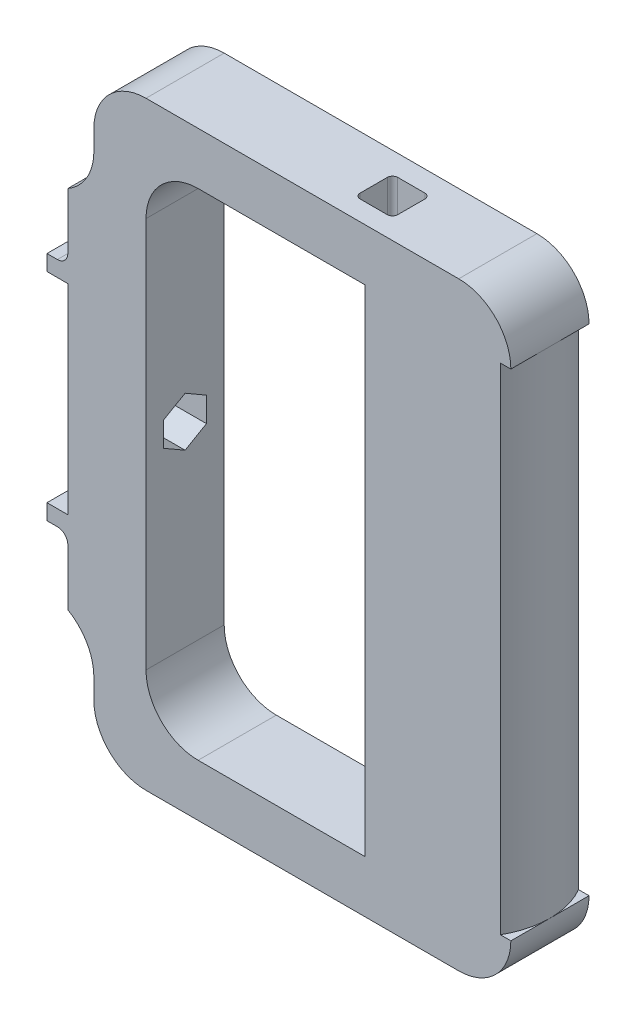
from build123d import *

# Parameters (mm, degrees)
MAIN_BODY_DEPTH             = 15
M5_HOLE_REACH               = 145.788
SKETCH2_R                   = 2.725
GRIP_REACH                  = 134.853
SKETCH8_W                   = 7.2
SKETCH8_H                   = 7.2
BUTTON_1_DEPTH              = 7
SKETCH9_R                   = 2
HOLE_WIRES_BUTTON_1_DEPTH   = 3
OUTER_FILLET_R              = 10
SKETCH13_W                  = 7.2
SKETCH13_H                  = 7.2
BUTTON_2_DEPTH              = 10
BUTTONS_FILLET_R            = 1
SKETCH16_R                  = 2
WIRE_ROUTING_DEPTH          = 40
M5_NUT_DEPTH                = 6
SKETCH18_W                  = 15
SKETCH18_H                  = 3
DOVETAIL_MALE_SLOT_DEPTH    = 4
DOVETAIL_MALE_SLOT_FILLET_R = 2


with BuildPart() as part:
    # Model → Main Body (new body)
    with BuildSketch(Plane.XY):
        Polygon((80, 115), (80, 105), (10, 105), (10, 10), (80, 10), (80, 0), (0, 0), (0, 22.5), (-5, 22.5), (-5, 92.5), (0, 92.5), (0, 115), align=None)
    extrude(amount=MAIN_BODY_DEPTH)

    # Sketch2 → M5 Hole (cut, up to next)
    with BuildSketch(Plane.ZY.offset(5), mode=Mode.PRIVATE) as m5_hole_sk1:
        with Locations((7.5, 57.5)):
            Circle(SKETCH2_R)
    m5_hole_tool1 = extrude(m5_hole_sk1.sketch, amount=-M5_HOLE_REACH, mode=Mode.PRIVATE) & part.part
    add(m5_hole_tool1.solids().sort_by_distance((-5, 57.5, 7.5))[0], mode=Mode.SUBTRACT)

    # Sketch6 → Grip (add, up to next)
    with BuildSketch(Plane.XZ.offset(-105), mode=Mode.PRIVATE) as grip_sk1:
        with BuildLine():
            Line((52.009621164, 15), (77.990380713, 15))
            ThreePointArc((77.990380713, 15), (80, 7.5), (77.990380713, 0))
            Line((77.990380713, 0), (52.009621164, 0))
            ThreePointArc((52.009621164, 0), (50.000002221, 7.5), (52.009621164, 15))
        make_face()
    grip_tool1 = extrude(grip_sk1.sketch, amount=GRIP_REACH, mode=Mode.PRIVATE) - part.part
    add(grip_tool1.solids().sort_by_distance((65.000001, 105, 7.5))[0])

    # Sketch8 → Button 1 (cut)
    with BuildSketch(Plane(origin=(0, 115, 0), x_dir=(1, 0, 0), z_dir=(0, 1, 0))):
        with Locations((49.9, -7.6)):
            Rectangle(SKETCH8_W, SKETCH8_H)
    extrude(amount=-BUTTON_1_DEPTH, mode=Mode.SUBTRACT)

    # Sketch9 → Hole Wires Button 1 (cut)
    with BuildSketch(Plane(origin=(0, 108, 0), x_dir=(1, 0, 0), z_dir=(0, 1, 0))):
        with Locations(Location((49.798571137, -7.7, 0), (0, 0, 270))):
            Circle(SKETCH9_R)
    extrude(amount=-HOLE_WIRES_BUTTON_1_DEPTH, mode=Mode.SUBTRACT)

    # Outer Fillet
    # the kernel refuses this fillet: 10 mm, written as the material it adds along each edge
    with BuildSketch(Plane(origin=(0, 22.5, 0), x_dir=(-1, 0, 0), z_dir=(0, 0, 1))) as outer_fillet_piece_1:
        with BuildLine():
            CenterArc((10, 8.660254038), OUTER_FILLET_R, 180, 60)
            Line((0, 8.660254038), (0, 0))
            Line((0, 0), (5, 0))
        make_face()
    extrude(amount=15)
    with BuildSketch(Plane(origin=(10, 10, 0), x_dir=(1, 0, 0), z_dir=(0, 0, 1)), Plane(origin=(10, 105, 0), x_dir=(0, -1, 0), z_dir=(0, 0, 1))) as outer_fillet_piece_2:
        with BuildLine():
            CenterArc((OUTER_FILLET_R, OUTER_FILLET_R), OUTER_FILLET_R, 180, 90)
            Line((0, OUTER_FILLET_R), (0, 0))
            Line((0, 0), (OUTER_FILLET_R, 0))
        make_face()
    extrude(amount=15)
    with BuildSketch(Plane(origin=(0, 92.5, 0), x_dir=(0, 1, 0), z_dir=(0, 0, 1))) as outer_fillet_piece_3:
        with BuildLine():
            CenterArc((8.660254038, 10), OUTER_FILLET_R, 210, 60)
            Line((0, 5), (0, 0))
            Line((0, 0), (8.660254038, 0))
        make_face()
    extrude(amount=15)
    # the kernel refuses this fillet: 10 mm, written as the material it takes off along each edge
    with BuildSketch(Plane(origin=(80, 115, -25), x_dir=(0, -1, 0), z_dir=(0, 0, 1)), Plane(origin=(80, 0, -25), x_dir=(-1, 0, 0), z_dir=(0, 0, 1)), Plane(origin=(0, 0, -25), x_dir=(0, 1, 0), z_dir=(0, 0, 1)), Plane(origin=(0, 115, -25), x_dir=(1, 0, 0), z_dir=(0, 0, 1))) as outer_fillet_2_piece_1:
        with BuildLine():
            CenterArc((OUTER_FILLET_R, -OUTER_FILLET_R), OUTER_FILLET_R, 90, 90)
            Line((0, -OUTER_FILLET_R), (0, 0))
            Line((0, 0), (OUTER_FILLET_R, 0))
        make_face()
    extrude(amount=65, mode=Mode.SUBTRACT)

    # Sketch13 → Button 2 (cut)
    with BuildSketch(Plane(origin=(0, 0, 0), x_dir=(-1, 0, 0), z_dir=(0, 0, -1))):
        with Locations((-10.1, 108.4)):
            Rectangle(SKETCH13_W, SKETCH13_H)
    extrude(amount=-BUTTON_2_DEPTH, mode=Mode.SUBTRACT)

    # Buttons Fillet
    buttons_fillet_edges = [part.edges().sort_by_distance(p)[0] for p in [
        (6.5, 112, 5),
        (6.5, 104.8, 5),
        (13.7, 104.8, 5),
        (13.7, 112, 5),
        (53.5, 111.5, 4),
        (53.5, 111.5, 11.2),
        (46.3, 111.5, 11.2),
        (46.3, 111.5, 4),
    ]]
    fillet(buttons_fillet_edges, radius=BUTTONS_FILLET_R)

    # Sketch16 → Wire Routing (cut, symmetric)
    with BuildSketch(Plane(origin=(10, 0, 0), x_dir=(0, 0, -1), z_dir=(1, 0, 0))):
        with Locations((-7.5, 105)):
            Circle(SKETCH16_R)
    extrude(amount=WIRE_ROUTING_DEPTH, both=True, mode=Mode.SUBTRACT)

    # Sketch17 → M5 Nut (cut)
    with BuildSketch(Plane(origin=(10, 0, 0), x_dir=(0, 0, -1), z_dir=(1, 0, 0))):
        Polygon((-7.5, 62.234272207), (-11.6, 59.867136104), (-11.6, 55.132863896), (-7.5, 52.765727793), (-3.4, 55.132863896), (-3.4, 59.867136104), align=None)
    extrude(amount=-M5_NUT_DEPTH, mode=Mode.SUBTRACT)

    # Sketch18 → Dovetail Male Slot (add)
    with BuildSketch(Plane.ZY.offset(5)):
        with Locations((7.5, 78.2)):
            Rectangle(SKETCH18_W, SKETCH18_H)
        with Locations((7.5, 36.8)):
            Rectangle(SKETCH18_W, SKETCH18_H)
    extrude(amount=DOVETAIL_MALE_SLOT_DEPTH)

    # Dovetail Male Slot Fillet
    dovetail_male_slot_fillet_edges = [part.edges().sort_by_distance(p)[0] for p in [
        (-5, 79.7, 7.5),
        (-5, 35.3, 7.5),
    ]]
    fillet(dovetail_male_slot_fillet_edges, radius=DOVETAIL_MALE_SLOT_FILLET_R)


solid = part.part
